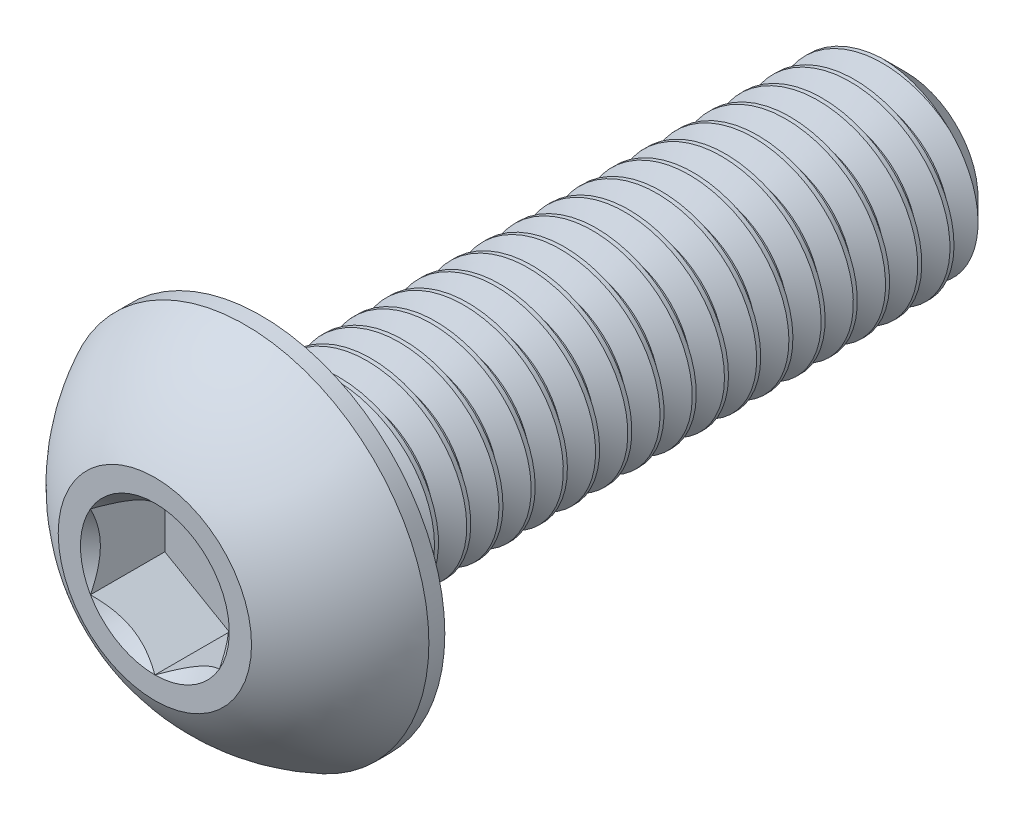
from build123d import *

# Parameters (mm, degrees)
SKETCH1_W          = 10
SKETCH1_H          = 1.5
CHAMFER1_SIZE      = 0.375
CUT_EXTRUDE2_DEPTH = 1.155
CUT_SWEEP1_PITCH   = 0.5


with BuildPart() as part:
    # Sketch1 → Revolve1 (revolve)
    with BuildSketch(Plane(origin=(0, 0, 0), x_dir=(0, 0, -1), z_dir=(1, 0, 0))):
        with Locations((6.65, 0.75)):
            Rectangle(SKETCH1_W, SKETCH1_H)
    revolve(axis=Axis((0, 0, -11.65), (0, 0, 1)))

    # Chamfer1
    chamfer1_edges = [part.edges().sort_by_distance(p)[0] for p in [
        (0, -1.5, -11.65),
    ]]
    chamfer(chamfer1_edges, length=CHAMFER1_SIZE)

    # Sketch7 → Revolve2 (revolve)
    with BuildSketch(Plane(origin=(0, 0, 0), x_dir=(0, 0, -1), z_dir=(1, 0, 0)), mode=Mode.PRIVATE) as revolve2_sk:
        with BuildLine():
            Line((1.4025, 2.85), (1.65, 2.85))
            Line((1.65, 2.85), (1.65, 0))
            Line((1.65, 0), (0, 0))
            Line((0, 0), (0, 1.5))
            ThreePointArc((0, 1.5), (0.59512511, 2.285251969), (1.4025, 2.85))
        make_face()
    revolve(revolve2_sk.sketch.rotate(Axis((0, 0, 0), (0, 0, -1)), 180), axis=Axis((0, 0, 0), (0, 0, -1)))

    # Sketch5 → Cut-Extrude2 (cut)
    with BuildSketch(Plane.XY):
        Polygon((1, -0.577350269), (1, 0.577350269), (0, 1.154700538), (-1, 0.577350269), (-1, -0.577350269), (0, -1.154700538), align=None)
    extrude(amount=-CUT_EXTRUDE2_DEPTH, mode=Mode.SUBTRACT)

    # Cut-Extrude3 cone 1 section (through the dimple's axis) → Cut-Extrude3 (revolve, cut)
    with BuildSketch(Plane(origin=(0, 0, 0), x_dir=(0, -1, 0), z_dir=(1, 0, 0))):
        Polygon((0, 0), (1.154700538, 0), (0, 1.154700538), align=None)
    revolve(axis=Axis((0, 0, 0), (0, 0, -1)), mode=Mode.SUBTRACT)

    # Cut-Sweep1: the profile of Sketch2 profile screwed along a right-hand helix of 21 turns, 6 arcs to a turn; built about Z, then put on its axis
    cut_sweep1_z = Axis((0, 0, 0), (0, 0, 1))
    cut_sweep1_corners = [(1.5003, 0, 0.375173205), (1.5003, 0, -0.062673205), (1.175240474, 0, 0.125), (1.175240474, 0, 0.1875)]
    with BuildLine(mode=Mode.PRIVATE) as cut_sweep1_profile:
        Line(cut_sweep1_corners[0], cut_sweep1_corners[1])
        Line(cut_sweep1_corners[1], cut_sweep1_corners[2])
        Line(cut_sweep1_corners[2], cut_sweep1_corners[3])
        Line(cut_sweep1_corners[3], cut_sweep1_corners[0])
    cut_sweep1_cap = Face(cut_sweep1_profile.wire())
    cut_sweep1_turn_angles = [0, 30, 60, 90, 120, 150, 180, 210, 240, 270, 300, 330, 360]
    cut_sweep1_turn_weights = [1, 0.8660254037844387, 1, 0.8660254037844387, 1, 0.8660254037844387, 1, 0.8660254037844387, 1, 0.8660254037844387, 1, 0.8660254037844387, 1]
    cut_sweep1_turn_rails = [Edge.make_bspline([Vector(p[0], p[1], 0).rotate(cut_sweep1_z, cut_sweep1_turn_angles[k]) / cut_sweep1_turn_weights[k] + Vector(0, 0, p[2] + CUT_SWEEP1_PITCH * cut_sweep1_turn_angles[k] / 360) for k in range(13)], [0, 0, 0, 1, 1, 2, 2, 3, 3, 4, 4, 5, 5, 6, 6, 6], 2, cut_sweep1_turn_weights) for p in cut_sweep1_corners]
    cut_sweep1_turn_sides = [Face.make_surface_from_curves(cut_sweep1_turn_rails[p[0]], cut_sweep1_turn_rails[p[1]]) for p in [(0, 1), (1, 2), (2, 3), (3, 0)]]
    cut_sweep1 = Plane(origin=(0, 0, -11.65), x_dir=(0, 1, 0), z_dir=(0, 0, 1)) * Solid(Shell([*[p.moved(Location((0, 0, CUT_SWEEP1_PITCH * i))) for i in range(21) for p in cut_sweep1_turn_sides], cut_sweep1_cap, cut_sweep1_cap.rotate(cut_sweep1_z, 7560).moved(Location((0, 0, CUT_SWEEP1_PITCH * 7560 / 360)))]))
    add(cut_sweep1, mode=Mode.SUBTRACT)


solid = part.part
